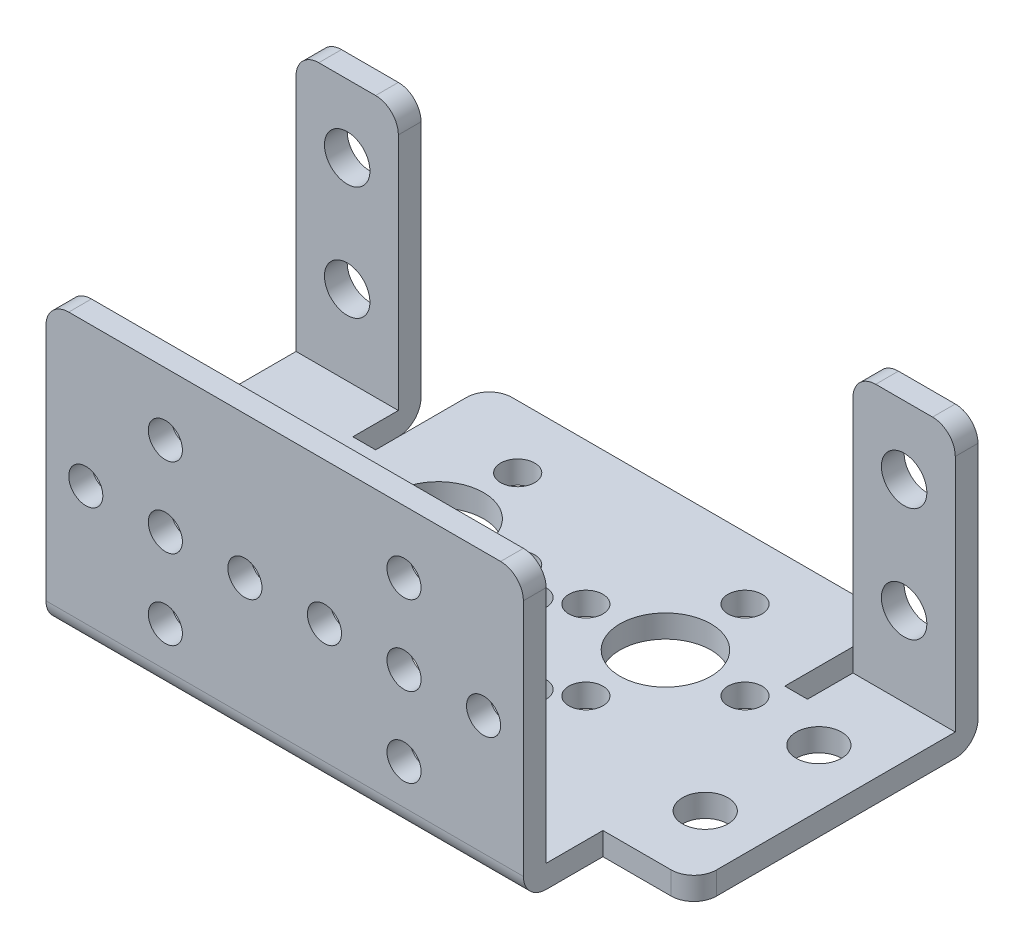
from build123d import *

# Parameters (mm, degrees)
SKETCH1_W           = 42
SKETCH1_H           = 25
SKETCH1_R           = 1.5
BOSS_EXTRUDE1_DEPTH = 2
SKETCH2_R           = 2
SKETCH2_R_2         = 4
SKETCH2_R_3         = 1.5
BOSS_EXTRUDE2_DEPTH = 2
CUT_EXTRUDE1_DEPTH  = 2
FILLET1_R           = 2
FILLET2_R           = 2
FILLET3_R           = 2
FILLET4_R           = 2
FILLET5_R           = 2
BOSS_EXTRUDE3_DEPTH = 2
FILLET6_R           = 2
FILLET7_R           = 2
SKETCH6_R           = 2
CUT_EXTRUDE2_DEPTH  = 2


with BuildPart() as part:
    # Sketch1 → Boss-Extrude1 (new body)
    with BuildSketch(Plane.XY):
        with Locations((21, 12.5)):
            Rectangle(SKETCH1_W, SKETCH1_H)
        with Locations((10.5, 12.5)):
            Circle(SKETCH1_R, mode=Mode.SUBTRACT)
        with Locations((10.5, 19.5)):
            Circle(SKETCH1_R, mode=Mode.SUBTRACT)
        with Locations((17.5, 12.5)):
            Circle(SKETCH1_R, mode=Mode.SUBTRACT)
        with Locations((3.5, 12.5)):
            Circle(SKETCH1_R, mode=Mode.SUBTRACT)
        with Locations((10.5, 5.5)):
            Circle(SKETCH1_R, mode=Mode.SUBTRACT)
        with Locations((31.5, 12.5)):
            Circle(SKETCH1_R, mode=Mode.SUBTRACT)
        with Locations((38.5, 12.5)):
            Circle(SKETCH1_R, mode=Mode.SUBTRACT)
        with Locations((31.5, 19.5)):
            Circle(SKETCH1_R, mode=Mode.SUBTRACT)
        with Locations((24.5, 12.5)):
            Circle(SKETCH1_R, mode=Mode.SUBTRACT)
        with Locations((31.5, 5.5)):
            Circle(SKETCH1_R, mode=Mode.SUBTRACT)
    extrude(amount=-BOSS_EXTRUDE1_DEPTH)

    # Sketch2 → Boss-Extrude2 (add)
    with BuildSketch(Plane.XZ):
        with BuildLine():
            Line((0, -32), (0, -36))
            Line((0, -36), (42, -36))
            Line((42, -36), (42, -32))
            Line((42, -32), (50, -32))
            Line((50, -32), (50, -9))
            ThreePointArc((50, -9), (49.414213562, -7.585786438), (48, -7))
            Line((48, -7), (42, -7))
            Line((42, -7), (42, 0))
            Line((42, 0), (0, 0))
            Line((0, 0), (0, -7))
            Line((0, -7), (-6, -7))
            ThreePointArc((-6, -7), (-7.414213562, -7.585786438), (-8, -9))
            Line((-8, -9), (-8, -32))
            Line((-8, -32), (0, -32))
        make_face()
        with Locations((45, -13)):
            Circle(SKETCH2_R, mode=Mode.SUBTRACT)
        with Locations((45, -23)):
            Circle(SKETCH2_R, mode=Mode.SUBTRACT)
        with Locations((-3, -13)):
            Circle(SKETCH2_R, mode=Mode.SUBTRACT)
        with Locations((-3, -23)):
            Circle(SKETCH2_R, mode=Mode.SUBTRACT)
        with Locations((11, -23.5)):
            Circle(SKETCH2_R_2, mode=Mode.SUBTRACT)
        with Locations((31, -23.5)):
            Circle(SKETCH2_R_2, mode=Mode.SUBTRACT)
        with Locations((21, -14.5)):
            Circle(SKETCH2_R_2, mode=Mode.SUBTRACT)
        with Locations((11, -16.5)):
            Circle(SKETCH2_R_3, mode=Mode.SUBTRACT)
        with Locations((11, -30.5)):
            Circle(SKETCH2_R_3, mode=Mode.SUBTRACT)
        with Locations((18, -23.5)):
            Circle(SKETCH2_R_3, mode=Mode.SUBTRACT)
        with Locations((4, -23.5)):
            Circle(SKETCH2_R_3, mode=Mode.SUBTRACT)
        with Locations((31, -30.5)):
            Circle(SKETCH2_R_3, mode=Mode.SUBTRACT)
        with Locations((24, -23.5)):
            Circle(SKETCH2_R_3, mode=Mode.SUBTRACT)
        with Locations((31, -16.5)):
            Circle(SKETCH2_R_3, mode=Mode.SUBTRACT)
        with Locations((38, -23.5)):
            Circle(SKETCH2_R_3, mode=Mode.SUBTRACT)
        with Locations((21, -21.5)):
            Circle(SKETCH2_R_3, mode=Mode.SUBTRACT)
        with Locations((21, -7.5)):
            Circle(SKETCH2_R_3, mode=Mode.SUBTRACT)
        with Locations((28, -14.5)):
            Circle(SKETCH2_R_3, mode=Mode.SUBTRACT)
        with Locations((14, -14.5)):
            Circle(SKETCH2_R_3, mode=Mode.SUBTRACT)
    extrude(amount=-BOSS_EXTRUDE2_DEPTH)

    # Sketch4 → Cut-Extrude1 (cut)
    with BuildSketch(Plane.XZ):
        Polygon((39, -36), (39, -26), (41, -26), (41, -32), (42, -32), (42, -36), align=None)
    cut_extrude1 = extrude(amount=-CUT_EXTRUDE1_DEPTH, mode=Mode.SUBTRACT)

    # Mirror1: Cut-Extrude1 across plane
    add(cut_extrude1.mirror(Plane(origin=(21, 0, 0), x_dir=(0, 0, 1), z_dir=(1, 0, 0))), mode=Mode.SUBTRACT)

    # Fillet1
    fillet1_edges = [part.edges().sort_by_distance(p)[0] for p in [
        (3, 1, -36),
    ]]
    fillet(fillet1_edges, radius=FILLET1_R)

    # Fillet2
    fillet2_edges = [part.edges().sort_by_distance(p)[0] for p in [
        (39, 1, -36),
    ]]
    fillet(fillet2_edges, radius=FILLET2_R)

    # Fillet3
    fillet3_edges = [part.edges().sort_by_distance(p)[0] for p in [
        (21, 0, 0),
    ]]
    fillet(fillet3_edges, radius=FILLET3_R)

    # Fillet4
    fillet4_edges = [part.edges().sort_by_distance(p)[0] for p in [
        (42, 25, -1),
    ]]
    fillet(fillet4_edges, radius=FILLET4_R)

    # Fillet5
    fillet5_edges = [part.edges().sort_by_distance(p)[0] for p in [
        (0, 25, -1),
    ]]
    fillet(fillet5_edges, radius=FILLET5_R)

    # Sketch5 → Boss-Extrude3 (add)
    with BuildSketch(Plane(origin=(0, 0, -32), x_dir=(-1, 0, 0), z_dir=(0, 0, -1))):
        with BuildLine():
            Line((8, 0), (-1, 0))
            Line((-1, 0), (-1, 23))
            ThreePointArc((-1, 23), (-0.414213562, 24.414213562), (1, 25))
            Line((1, 25), (6, 25))
            ThreePointArc((6, 25), (7.414213562, 24.414213562), (8, 23))
            Line((8, 23), (8, 0))
        make_face()
    boss_extrude3 = extrude(amount=-BOSS_EXTRUDE3_DEPTH)

    # Mirror2: Boss-Extrude3 across plane
    add(boss_extrude3.mirror(Plane(origin=(21, 0, 0), x_dir=(0, 0, 1), z_dir=(1, 0, 0))))

    # Fillet6
    fillet6_edges = [part.edges().sort_by_distance(p)[0] for p in [
        (45.5, 0, -32),
    ]]
    fillet(fillet6_edges, radius=FILLET6_R)

    # Fillet7
    fillet7_edges = [part.edges().sort_by_distance(p)[0] for p in [
        (-3.5, 0, -32),
    ]]
    fillet(fillet7_edges, radius=FILLET7_R)

    # Sketch6 → Cut-Extrude2 (cut)
    with BuildSketch(Plane(origin=(0, 0, -32), x_dir=(-1, 0, 0), z_dir=(0, 0, -1))):
        with Locations((3.5, 19)):
            Circle(SKETCH6_R)
        with Locations((3.5, 9)):
            Circle(SKETCH6_R)
    cut_extrude2 = extrude(amount=-CUT_EXTRUDE2_DEPTH, mode=Mode.SUBTRACT)

    # Mirror3: Cut-Extrude2 across plane
    add(cut_extrude2.mirror(Plane(origin=(21, 0, 0), x_dir=(0, 0, 1), z_dir=(1, 0, 0))), mode=Mode.SUBTRACT)


solid = part.part
